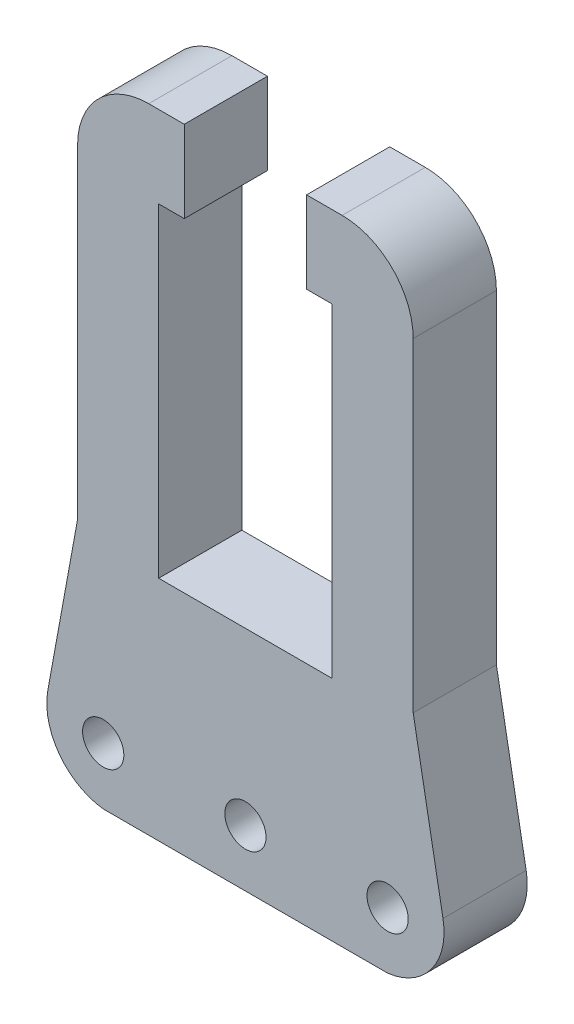
from build123d import *

# Parameters (mm, degrees)
MODEL_R             = 1.45
BOSS_EXTRUDE1_DEPTH = 5.85


with BuildPart() as part:
    # Model → Boss-Extrude1 (new body)
    with BuildSketch(Plane.XY):
        with BuildLine():
            Line((508.182236888, 554.934833401), (506.087301785, 543.461595882))
            ThreePointArc((506.087301785, 543.461595882), (506.893587564, 539.980874482), (509.982236888, 538.184833401))
            Line((509.982236888, 538.184833401), (529.982236888, 538.184833401))
            ThreePointArc((529.982236888, 538.184833401), (533.070886212, 539.980874482), (533.877171991, 543.461595882))
            Line((533.877171991, 543.461595882), (531.782236888, 554.934833401))
            Line((531.782236888, 554.934833401), (531.782236888, 577.734833401))
            ThreePointArc((531.782236888, 577.734833401), (530.317770794, 581.270367307), (526.782236888, 582.734833401))
            Line((526.782236888, 582.734833401), (524.282236888, 582.734833401))
            Line((524.282236888, 582.734833401), (524.282236888, 576.984833401))
            Line((524.282236888, 576.984833401), (526.082236888, 576.984833401))
            Line((526.082236888, 576.984833401), (526.082236888, 554.184833401))
            Line((526.082236888, 554.184833401), (513.882236888, 554.184833401))
            Line((513.882236888, 554.184833401), (513.882236888, 576.984833401))
            Line((513.882236888, 576.984833401), (515.682236888, 576.984833401))
            Line((515.682236888, 576.984833401), (515.682236888, 582.734833401))
            Line((515.682236888, 582.734833401), (513.182236888, 582.734833401))
            ThreePointArc((513.182236888, 582.734833401), (509.646702982, 581.270367307), (508.182236888, 577.734833401))
            Line((508.182236888, 577.734833401), (508.182236888, 554.934833401))
        make_face()
        with Locations((509.982236888, 542.184833401)):
            Circle(MODEL_R, mode=Mode.SUBTRACT)
        with Locations((519.982236888, 542.184833401)):
            Circle(MODEL_R, mode=Mode.SUBTRACT)
        with Locations((529.982236888, 542.184833401)):
            Circle(MODEL_R, mode=Mode.SUBTRACT)
    extrude(amount=BOSS_EXTRUDE1_DEPTH)


solid = part.part
